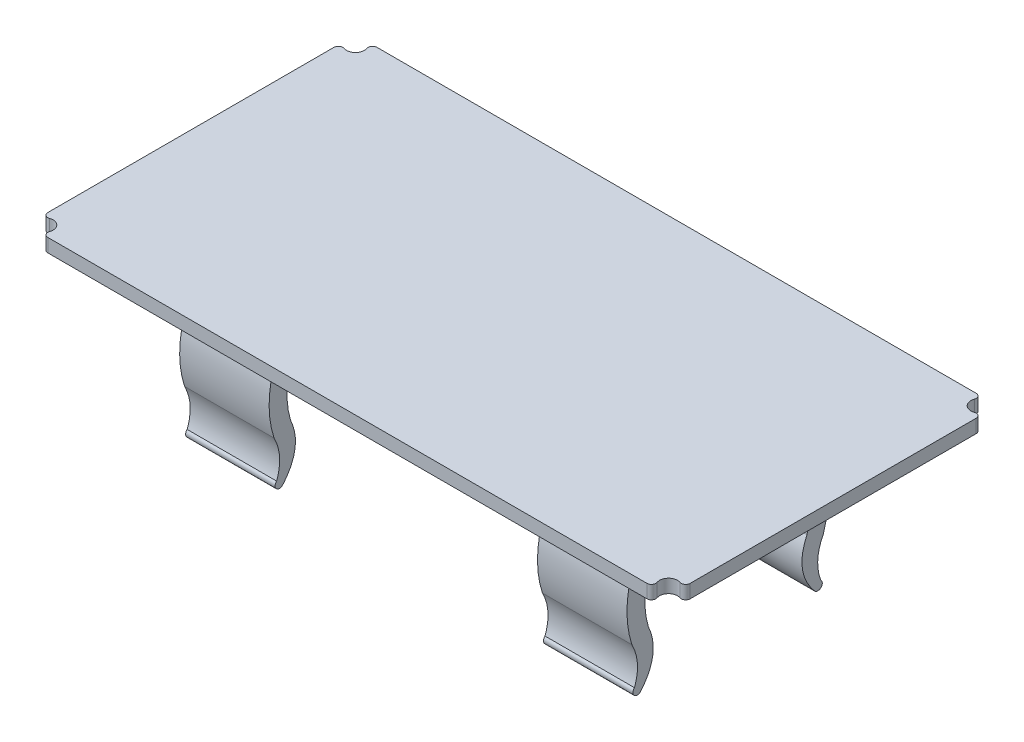
from build123d import *

# Parameters (mm, degrees)
BOSS_EXTRUDE1_DEPTH = 1.5
BOSS_EXTRUDE2_START = -10
BOSS_EXTRUDE2_DEPTH = 10
BOSS_EXTRUDE3_START = -50
BOSS_EXTRUDE3_DEPTH = 10
FILLET1_R           = 2


with BuildPart() as part:
    # Sketch1 → Boss-Extrude1 (new body)
    with BuildSketch(Plane(origin=(0, 0, 0), x_dir=(1, 0, 0), z_dir=(0, 1, 0))):
        with BuildLine():
            Line((2.414213562, 0), (69.385786438, 0))
            ThreePointArc((69.385786438, 0), (69.794034728, 0.211324865), (69.857190958, 0.666666667))
            ThreePointArc((69.857190958, 0.666666667), (70.092893219, 1.707106781), (71.133333333, 1.942809042))
            ThreePointArc((71.133333333, 1.942809042), (71.588675135, 2.005965272), (71.8, 2.414213562))
            Line((71.8, 2.414213562), (71.8, 34.385786438))
            ThreePointArc((71.8, 34.385786438), (71.588675135, 34.794034728), (71.133333333, 34.857190958))
            ThreePointArc((71.133333333, 34.857190958), (70.092893219, 35.092893219), (69.857190958, 36.133333333))
            ThreePointArc((69.857190958, 36.133333333), (69.794034728, 36.588675135), (69.385786438, 36.8))
            Line((69.385786438, 36.8), (2.414213562, 36.8))
            ThreePointArc((2.414213562, 36.8), (2.005965272, 36.588675135), (1.942809042, 36.133333333))
            ThreePointArc((1.942809042, 36.133333333), (1.707106781, 35.092893219), (0.666666667, 34.857190958))
            ThreePointArc((0.666666667, 34.857190958), (0.211324865, 34.794034728), (0, 34.385786438))
            Line((0, 34.385786438), (0, 2.414213562))
            ThreePointArc((0, 2.414213562), (0.211324865, 2.005965272), (0.666666667, 1.942809042))
            ThreePointArc((0.666666667, 1.942809042), (1.707106781, 1.707106781), (1.942809042, 0.666666667))
            ThreePointArc((1.942809042, 0.666666667), (2.005965272, 0.211324865), (2.414213562, 0))
        make_face()
    extrude(amount=BOSS_EXTRUDE1_DEPTH)

    # Sketch3 → Boss-Extrude2 (add)
    with BuildSketch(Plane.ZY.offset(BOSS_EXTRUDE2_START)):
        with BuildLine():
            Line((-12.374014603, 0), (-24.425985397, 0))
            ThreePointArc((-24.425985397, 0), (-28.985147861, -5.689862894), (-29.098192593, -12.980111382))
            add(Edge.make_bspline(
                [(-29.098192593, -12.980111382), (-28.008215886, -15.088393425), (-28.812062275, -17.288254713)],
                knots=[0, 0, 0, 1, 1, 1], degree=2))
            ThreePointArc((-28.812062275, -17.288254713), (-28.884218098, -17.970726587), (-28.207085889, -18.082379143))
            add(Edge.make_bspline(
                [(-27.268409249, -12.129413886), (-25.798302719, -15.345900972), (-28.207085889, -18.082379143)],
                knots=[0, 0, 0, 1, 1, 1], degree=2))
            ThreePointArc((-27.268409249, -12.129413886), (-18.4, -0.25), (-9.531590751, -12.129413886))
            add(Edge.make_bspline(
                [(-9.531590751, -12.129413886), (-11.001697281, -15.345900972), (-8.592914111, -18.082379143)],
                knots=[0, 0, 0, 1, 1, 1], degree=2))
            ThreePointArc((-8.592914111, -18.082379143), (-7.915781902, -17.970726587), (-7.987937725, -17.288254713))
            add(Edge.make_bspline(
                [(-7.701807407, -12.980111382), (-8.791784114, -15.088393425), (-7.987937725, -17.288254713)],
                knots=[0, 0, 0, 1, 1, 1], degree=2))
            ThreePointArc((-7.701807407, -12.980111382), (-7.814852139, -5.689862894), (-12.374014603, 0))
        make_face()
    extrude(amount=-BOSS_EXTRUDE2_DEPTH)

    # Sketch3<3> → Boss-Extrude3 (add)
    with BuildSketch(Plane.ZY.offset(BOSS_EXTRUDE3_START)):
        with BuildLine():
            Line((-24.425985397, 0), (-12.374014603, 0))
            ThreePointArc((-12.374014603, 0), (-7.814852139, -5.689862894), (-7.701807407, -12.980111382))
            add(Edge.make_bspline(
                [(-7.701807407, -12.980111382), (-8.791784114, -15.088393425), (-7.987937725, -17.288254713)],
                knots=[0, 0, 0, 1, 1, 1], degree=2))
            ThreePointArc((-7.987937725, -17.288254713), (-7.915781902, -17.970726587), (-8.592914111, -18.082379143))
            add(Edge.make_bspline(
                [(-9.531590751, -12.129413886), (-11.001697281, -15.345900972), (-8.592914111, -18.082379143)],
                knots=[0, 0, 0, 1, 1, 1], degree=2))
            ThreePointArc((-9.531590751, -12.129413886), (-18.4, -0.25), (-27.268409249, -12.129413886))
            add(Edge.make_bspline(
                [(-27.268409249, -12.129413886), (-25.798302719, -15.345900972), (-28.207085889, -18.082379143)],
                knots=[0, 0, 0, 1, 1, 1], degree=2))
            ThreePointArc((-28.207085889, -18.082379143), (-28.884218098, -17.970726587), (-28.812062275, -17.288254713))
            add(Edge.make_bspline(
                [(-29.098192593, -12.980111382), (-28.008215886, -15.088393425), (-28.812062275, -17.288254713)],
                knots=[0, 0, 0, 1, 1, 1], degree=2))
            ThreePointArc((-29.098192593, -12.980111382), (-28.985147861, -5.689862894), (-24.425985397, 0))
        make_face()
    extrude(amount=-BOSS_EXTRUDE3_DEPTH)

    # Fillet1
    fillet1_edges = [part.edges().sort_by_distance(p)[0] for p in [
        (55, 0, -24.425985397),
        (15, 0, -24.425985397),
        (55, 0, -12.374014603),
        (15, 0, -12.374014603),
    ]]
    fillet(fillet1_edges, radius=FILLET1_R)


solid = part.part
